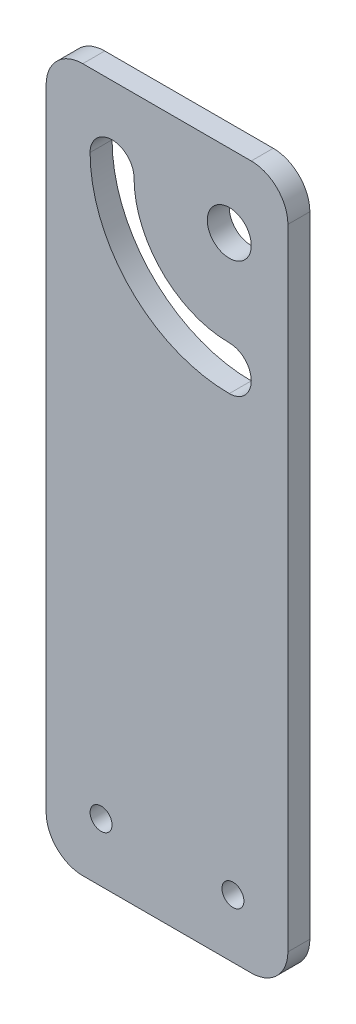
from build123d import *

# Parameters (mm, degrees)
ESBO_O1_R                = 3
ESBO_O1_R_2              = 1.5
RESSALTO_EXTRUS_O2_DEPTH = 3


with BuildPart() as part:
    # Esboço1 → Ressalto-extrusão2 (new body)
    with BuildSketch(Plane.XY):
        with BuildLine():
            Line((5, 50), (28, 50))
            ThreePointArc((28, 50), (31.535533906, 48.535533906), (33, 45))
            Line((33, 45), (33, -41))
            ThreePointArc((33, -41), (31.535533906, -44.535533906), (28, -46))
            Line((28, -46), (5, -46))
            ThreePointArc((5, -46), (1.464466094, -44.535533906), (0, -41))
            Line((0, -41), (0, 45))
            ThreePointArc((0, 45), (1.464466094, 48.535533906), (5, 50))
        make_face()
        with Locations((25, 40)):
            Circle(ESBO_O1_R, mode=Mode.SUBTRACT)
        with Locations((25.5, -38)):
            Circle(ESBO_O1_R_2, mode=Mode.SUBTRACT)
        with Locations((7.5, -38)):
            Circle(ESBO_O1_R_2, mode=Mode.SUBTRACT)
        with BuildLine():
            ThreePointArc((6, 40), (11.564971157, 26.564971157), (25, 21))
            ThreePointArc((25, 21), (28, 24), (25, 27))
            ThreePointArc((25, 27), (15.807611845, 30.807611845), (12, 40))
            ThreePointArc((12, 40), (9, 43), (6, 40))
        make_face(mode=Mode.SUBTRACT)
    extrude(amount=RESSALTO_EXTRUS_O2_DEPTH)


solid = part.part
